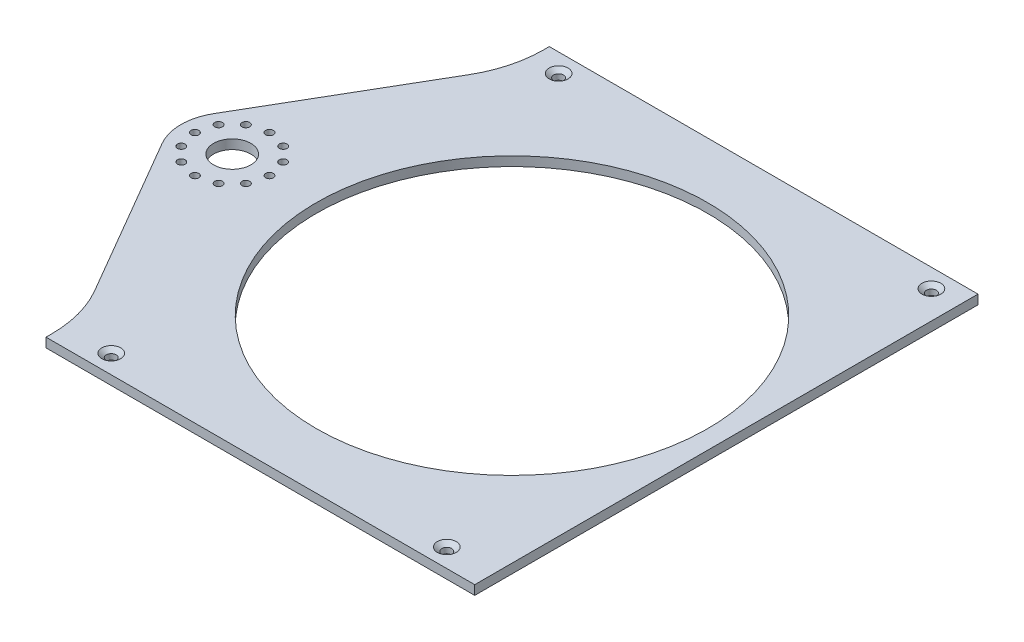
from build123d import *

# Parameters (mm, degrees)
SKETCH1_R                                           = 133.35
SKETCH1_R_2                                         = 12.7
SKETCH1_R_3                                         = 2.6289
EXTRUDE_CENTER_HOLE_DEPTH                           = 6.35
CSK_FOR_1_4_FLAT_HEAD_MACHINE_SCREW_100_D           = 6.7564
CSK_FOR_1_4_FLAT_HEAD_MACHINE_SCREW_100_CSINK_D     = 12.8778
CSK_FOR_1_4_FLAT_HEAD_MACHINE_SCREW_100_CSINK_ANGLE = 100
FILLET1_R                                           = 79.796453401


with BuildPart() as part:
    # Sketch1 → Extrude & center hole (new body)
    with BuildSketch(Plane(origin=(0, 0, 0), x_dir=(1, 0, 0), z_dir=(0, 1, 0))):
        with BuildLine():
            Line((0, 171.45), (146.05, 171.45))
            Line((146.05, 171.45), (146.05, 0))
            Line((146.05, 0), (146.05, -171.45))
            Line((146.05, -171.45), (-146.05, -171.45))
            Line((-146.05, -171.45), (-146.05, -146.05))
            Line((-146.05, -146.05), (-220.811204994, -17.564625007))
            ThreePointArc((-220.811204994, -17.564625007), (-225.54946, 0), (-220.811204994, 17.564625007))
            Line((-220.811204994, 17.564625007), (-146.05, 146.05))
            Line((-146.05, 146.05), (-146.05, 171.45))
            Line((-146.05, 171.45), (0, 171.45))
        make_face()
        Circle(SKETCH1_R, mode=Mode.SUBTRACT)
        with Locations((-190.62446, 0)):
            Circle(SKETCH1_R_2, mode=Mode.SUBTRACT)
        with Locations((-190.62446, 25.4)):
            Circle(SKETCH1_R_3, mode=Mode.SUBTRACT)
        with Locations((-177.92446, 21.997045256)):
            Circle(SKETCH1_R_3, mode=Mode.SUBTRACT)
        with Locations((-168.627414744, 12.7)):
            Circle(SKETCH1_R_3, mode=Mode.SUBTRACT)
        with Locations((-165.22446, 0)):
            Circle(SKETCH1_R_3, mode=Mode.SUBTRACT)
        with Locations((-168.627414744, -12.7)):
            Circle(SKETCH1_R_3, mode=Mode.SUBTRACT)
        with Locations((-177.92446, -21.997045256)):
            Circle(SKETCH1_R_3, mode=Mode.SUBTRACT)
        with Locations((-190.62446, -25.4)):
            Circle(SKETCH1_R_3, mode=Mode.SUBTRACT)
        with Locations((-203.32446, -21.997045256)):
            Circle(SKETCH1_R_3, mode=Mode.SUBTRACT)
        with Locations((-212.621505256, -12.7)):
            Circle(SKETCH1_R_3, mode=Mode.SUBTRACT)
        with Locations((-216.02446, 0)):
            Circle(SKETCH1_R_3, mode=Mode.SUBTRACT)
        with Locations((-212.621505256, 12.7)):
            Circle(SKETCH1_R_3, mode=Mode.SUBTRACT)
        with Locations((-203.32446, 21.997045256)):
            Circle(SKETCH1_R_3, mode=Mode.SUBTRACT)
    extrude(amount=EXTRUDE_CENTER_HOLE_DEPTH)

    # CSK for 1/4 Flat Head Machine Screw (100)1 (through all)
    with Locations(Plane(origin=(0, 6.35, 0), x_dir=(1, 0, 0), z_dir=(0, 1, 0))):
        with Locations((-114.3, -158.75), (114.3, -158.75), (127, 158.75), (-127, 158.75)):
            CounterSinkHole(CSK_FOR_1_4_FLAT_HEAD_MACHINE_SCREW_100_D / 2, CSK_FOR_1_4_FLAT_HEAD_MACHINE_SCREW_100_CSINK_D / 2, counter_sink_angle=CSK_FOR_1_4_FLAT_HEAD_MACHINE_SCREW_100_CSINK_ANGLE)

    # Fillet1
    fillet1_edges = [part.edges().sort_by_distance(p)[0] for p in [
        (-146.05, 3.175, 146.05),
        (-146.05, 3.175, -146.05),
    ]]
    fillet(fillet1_edges, radius=FILLET1_R)


solid = part.part
